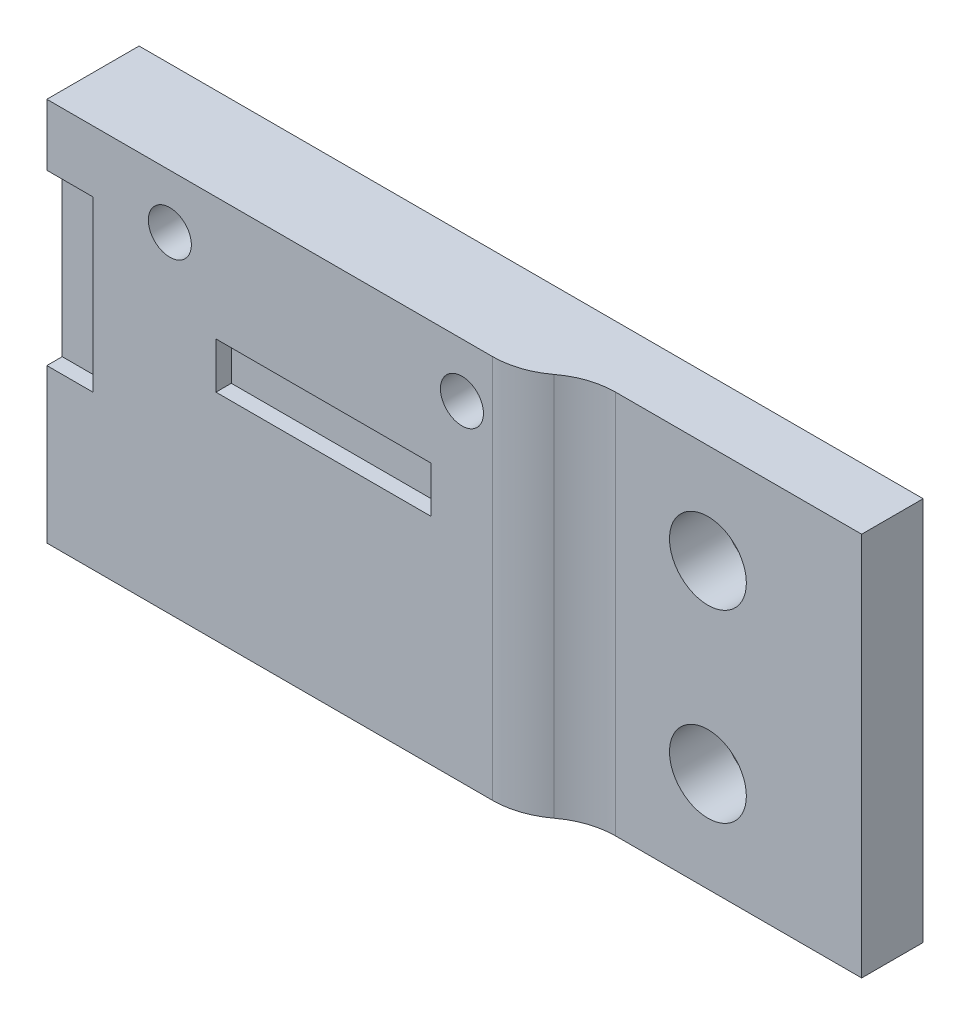
from build123d import *

# Parameters (mm, degrees)
SKETCH1_W           = 40
SKETCH1_H           = 25
BOSS_EXTRUDE1_DEPTH = 6
CUT_EXTRUDE1_START  = 6
SKETCH3_W           = 14
SKETCH3_H           = 3
SKETCH3_W_2         = 3
SKETCH3_H_2         = 11
CUT_EXTRUDE1_DEPTH  = 1
SKETCH4_R           = 1.4
CUT_EXTRUDE2_DEPTH  = 11
SKETCH7_W           = 9
SKETCH7_H           = 25
CUT_EXTRUDE5_DEPTH  = 21
SKETCH8_W           = 20
SKETCH8_H           = 25
BOSS_EXTRUDE2_DEPTH = 4
SKETCH9_R           = 2.5
CUT_EXTRUDE6_DEPTH  = 43.334973721
CUT_EXTRUDE7_DEPTH  = 0.5
FILLET3_R           = 1
FILLET4_R           = 5
FILLET5_R           = 5


with BuildPart() as part:
    # Sketch1 → Boss-Extrude1 (new body)
    with BuildSketch(Plane.XY):
        Rectangle(SKETCH1_W, SKETCH1_H)
    extrude(amount=BOSS_EXTRUDE1_DEPTH)

    # Sketch3 → Cut-Extrude1 (cut)
    with BuildSketch(Plane.XY.offset(CUT_EXTRUDE1_START)):
        with Locations((7, 3)):
            Rectangle(SKETCH3_W, SKETCH3_H)
        with Locations((-9.5, 3)):
            Rectangle(SKETCH3_W_2, SKETCH3_H_2)
    extrude(amount=-CUT_EXTRUDE1_DEPTH, mode=Mode.SUBTRACT)

    # Sketch4 → Cut-Extrude2 (cut)
    with BuildSketch(Plane.XY):
        with Locations(Location((16, 9, 0), (0, 0, 180))):
            Circle(SKETCH4_R)
        with Locations(Location((-3, 9, 0), (0, 0, 180))):
            Circle(SKETCH4_R)
    extrude(amount=CUT_EXTRUDE2_DEPTH, mode=Mode.SUBTRACT)

    # Sketch7 → Cut-Extrude5 (cut)
    with BuildSketch(Plane.XY):
        with Locations((-15.5, 0)):
            Rectangle(SKETCH7_W, SKETCH7_H)
    extrude(amount=CUT_EXTRUDE5_DEPTH, mode=Mode.SUBTRACT)

    # Sketch8 → Boss-Extrude2 (add)
    with BuildSketch(Plane.XY):
        with Locations((30, 0)):
            Rectangle(SKETCH8_W, SKETCH8_H)
    extrude(amount=BOSS_EXTRUDE2_DEPTH)

    # Sketch9 → Cut-Extrude6 (cut, through all)
    with BuildSketch(Plane.XY):
        with Locations((30, 6)):
            Circle(SKETCH9_R)
        with Locations(Location((30, -6, 0), (0, 0, 180))):
            Circle(SKETCH9_R)
    extrude(amount=CUT_EXTRUDE6_DEPTH, mode=Mode.SUBTRACT)

    # Sketch10 → Cut-Extrude7 (cut)
    with BuildSketch(Plane.XY):
        with BuildLine():
            Line((27.452141011, -0.567835185), (27.452141011, 0.567835185))
            ThreePointArc((27.452141011, 0.567835185), (29.956756767, 11.999844167), (32.625893719, 0.605124452))
            Line((32.625893719, 0.605124452), (32.625893719, 0.058283872))
            Line((32.625893719, 0.058283872), (32.625893719, -0.605124452))
            ThreePointArc((32.625893719, -0.605124452), (29.956756767, -11.999844167), (27.452141011, -0.567835185))
        make_face()
    extrude(amount=CUT_EXTRUDE7_DEPTH, mode=Mode.SUBTRACT)

    # Fillet3
    # the kernel refuses this fillet: 1 mm, written as the material it takes off along each edge
    with BuildSketch(Plane(origin=(27.452141011, -0.567835185, -1.505321413), x_dir=(-0.8846564558137137, -0.466243450556808, 0), z_dir=(0, 0, 1))) as fillet3_piece_1:
        with BuildLine():
            CenterArc((0.603917956, -0.998920373), FILLET3_R, 92.662646755, 59.546627489)
            Line((-0.2807385, -0.532676923), (0, 0))
            ThreePointArc((0, 0), (0.278731364, -0.006477761), (0.557462728, 0))
        make_face()
    extrude(amount=2.005321413, mode=Mode.SUBTRACT)
    with BuildSketch(Plane(origin=(27.452141011, 0.567835185, -1.505321413), x_dir=(-0.8846564558137143, 0.46624345055680716, 0), z_dir=(0, 0, 1))) as fillet3_piece_2:
        with BuildLine():
            CenterArc((0.603917956, 0.998920373), FILLET3_R, 207.790725756, 59.546627489)
            Line((-0.2807385, 0.532676923), (0, 0))
            ThreePointArc((0, 0), (0.278731364, 0.006477761), (0.557462728, 0))
        make_face()
    extrude(amount=2.005321413, mode=Mode.SUBTRACT)
    with BuildSketch(Plane(origin=(32.625893719, -0.605124452, -1.482132829), x_dir=(0.8781869817379448, -0.4783174940413514, 0), z_dir=(0, 0, 1))) as fillet3_piece_3:
        with BuildLine():
            CenterArc((0.594614958, 0.998953396), FILLET3_R, 208.575572443, 58.80282617)
            Line((-0.283572024, 0.520635902), (0, 0))
            ThreePointArc((0, 0), (0.274437673, 0.006279622), (0.548875345, 0))
        make_face()
    extrude(amount=1.982132829, mode=Mode.SUBTRACT)
    with BuildSketch(Plane(origin=(32.625893719, 0.605124452, -1.482132829), x_dir=(0, -1, 0), z_dir=(0, 0, 1))) as fillet3_piece_4:
        with BuildLine():
            CenterArc((0.592853132, 1), FILLET3_R, 211.19717383, 58.80282617)
            ThreePointArc((-0.26253668, 0.482015183), (-0.125753657, 0.244011245), (0, 0))
            Line((0, 0), (0.592853132, 0))
        make_face()
    extrude(amount=1.982132829, mode=Mode.SUBTRACT)

    # Fillet4
    # the kernel refuses this fillet: 5 mm, written as the material it adds along each edge
    with BuildSketch(Plane(origin=(20, -12.5, 4), x_dir=(0, 0, 1), z_dir=(0, 1, 0))) as fillet4_piece_1:
        with BuildLine():
            CenterArc((5, 4), FILLET4_R, 180, 53.130102354)
            Line((0, 4), (-0.1, 4))
            Line((-0.1, 4), (-0.1, 0))
            Line((-0.1, 0), (0, -0.1))
            ThreePointArc((0, -0.1), (1, -0.1), (1.94, -0.08))
            Line((1.94, -0.08), (2, 0))
        make_face()
    extrude(amount=25)

    # Fillet5
    fillet5_edges = [part.edges().sort_by_distance(p)[0] for p in [
        (20, 0, 6),
    ]]
    fillet(fillet5_edges, radius=FILLET5_R)


solid = part.part
